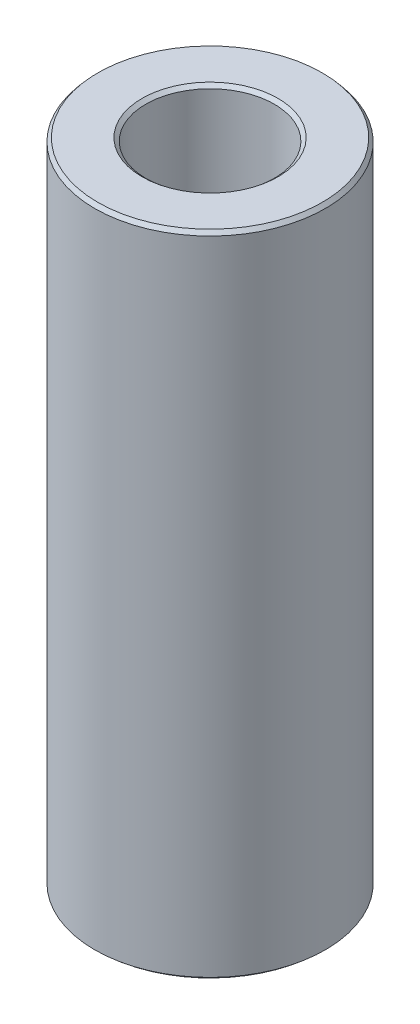
from build123d import *
from OCP.BRepFilletAPI import BRepFilletAPI_MakeChamfer

# Parameters (mm, degrees)
SKETCH1_R           = 30
BOSS_EXTRUDE1_DEPTH = 168.758989362
SKETCH2_R           = 16.711335617
CUT_EXTRUDE1_DEPTH  = 175.010334436
CHAMFER1_SIZE       = 0.969950572
CHAMFER1_SIZE2      = 0.815779865


with BuildPart() as part:
    # Sketch1 → Boss-Extrude1 (new body)
    with BuildSketch(Plane(origin=(0, 0, 0), x_dir=(1, 0, 0), z_dir=(0, 1, 0))):
        Circle(SKETCH1_R)
    extrude(amount=BOSS_EXTRUDE1_DEPTH)

    # Sketch2 → Cut-Extrude1 (cut, through all)
    with BuildSketch(Plane(origin=(0, 0, 0), x_dir=(1, 0, 0), z_dir=(0, 1, 0))):
        Circle(SKETCH2_R)
    extrude(amount=CUT_EXTRUDE1_DEPTH, mode=Mode.SUBTRACT)

    # Chamfer1: one chamfer whose edges measure the first distance from different faces: ONE call of the kernel's chamfer builder (chamfer() names one face for all edges)
    chamfer1_edges_1 = [part.edges().sort_by_distance(p)[0] for p in [
        (-16.711335617, 168.758989362, 0),
    ]]
    chamfer1_side_1 = [part.faces().sort_by_distance(p)[0] for p in [
        (-29.151471863, 168.758989362, 0),
    ]]
    chamfer1_edges_2 = [part.edges().sort_by_distance(p)[0] for p in [
        (-16.711335617, 0, 0),
    ]]
    chamfer1_side_2 = [part.faces().sort_by_distance(p)[0] for p in [
        (-16.711335617, 84.379494681, 0),
    ]]
    chamfer1_edges_3 = [part.edges().sort_by_distance(p)[0] for p in [
        (-30, 0, 0),
    ]]
    chamfer1_side_3 = [part.faces().sort_by_distance(p)[0] for p in [
        (-29.151471863, 0, 0),
    ]]
    chamfer1_edges_4 = [part.edges().sort_by_distance(p)[0] for p in [
        (-30, 168.758989362, 0),
    ]]
    chamfer1_side_4 = [part.faces().sort_by_distance(p)[0] for p in [
        (-30, 84.379494681, 0),
    ]]
    chamfer1 = BRepFilletAPI_MakeChamfer(part.part.solid().wrapped)
    for e in chamfer1_edges_1:
        chamfer1.Add(CHAMFER1_SIZE, CHAMFER1_SIZE2, e.wrapped, chamfer1_side_1[0].wrapped)  # the first distance lies on this face
    for e in chamfer1_edges_2:
        chamfer1.Add(CHAMFER1_SIZE, CHAMFER1_SIZE2, e.wrapped, chamfer1_side_2[0].wrapped)  # the first distance lies on this face
    for e in chamfer1_edges_3:
        chamfer1.Add(CHAMFER1_SIZE, CHAMFER1_SIZE2, e.wrapped, chamfer1_side_3[0].wrapped)  # the first distance lies on this face
    for e in chamfer1_edges_4:
        chamfer1.Add(CHAMFER1_SIZE, CHAMFER1_SIZE2, e.wrapped, chamfer1_side_4[0].wrapped)  # the first distance lies on this face
    add(Compound.cast(chamfer1.Shape()), mode=Mode.REPLACE)


solid = part.part
